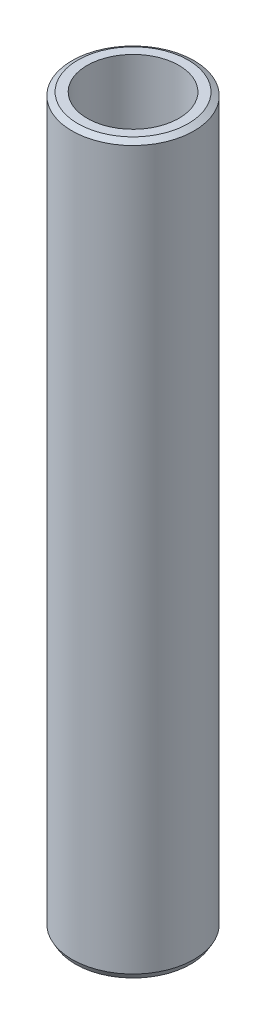
from build123d import *
from OCP.BRepFilletAPI import BRepFilletAPI_MakeChamfer

# Parameters (mm, degrees)
SKETCH1_R           = 37.5
BOSS_EXTRUDE1_DEPTH = 446.828968533
SKETCH2_R           = 28.219254895
CUT_EXTRUDE1_DEPTH  = 450.965139895
CHAMFER1_SIZE       = 2.072617868
CHAMFER1_SIZE2      = 3.589879451


with BuildPart() as part:
    # Sketch1 → Boss-Extrude1 (new body)
    with BuildSketch(Plane(origin=(0, 0, 0), x_dir=(1, 0, 0), z_dir=(0, 1, 0))):
        Circle(SKETCH1_R)
    extrude(amount=BOSS_EXTRUDE1_DEPTH)

    # Sketch2 → Cut-Extrude1 (cut, through all)
    with BuildSketch(Plane(origin=(0, 0, 0), x_dir=(1, 0, 0), z_dir=(0, 1, 0))):
        Circle(SKETCH2_R)
    extrude(amount=CUT_EXTRUDE1_DEPTH, mode=Mode.SUBTRACT)

    # Chamfer1: one chamfer whose edges measure the first distance from different faces: ONE call of the kernel's chamfer builder (chamfer() names one face for all edges)
    chamfer1_edges_1 = [part.edges().sort_by_distance(p)[0] for p in [
        (-37.5, 446.828968533, 0),
    ]]
    chamfer1_side_1 = [part.faces().sort_by_distance(p)[0] for p in [
        (-37.5, 223.414484267, 0),
    ]]
    chamfer1_edges_2 = [part.edges().sort_by_distance(p)[0] for p in [
        (-37.5, 0, 0),
    ]]
    chamfer1_side_2 = [part.faces().sort_by_distance(p)[0] for p in [
        (-36.439339828, 0, 0),
    ]]
    chamfer1 = BRepFilletAPI_MakeChamfer(part.part.solid().wrapped)
    for e in chamfer1_edges_1:
        chamfer1.Add(CHAMFER1_SIZE, CHAMFER1_SIZE2, e.wrapped, chamfer1_side_1[0].wrapped)  # the first distance lies on this face
    for e in chamfer1_edges_2:
        chamfer1.Add(CHAMFER1_SIZE, CHAMFER1_SIZE2, e.wrapped, chamfer1_side_2[0].wrapped)  # the first distance lies on this face
    add(Compound.cast(chamfer1.Shape()), mode=Mode.REPLACE)


solid = part.part
